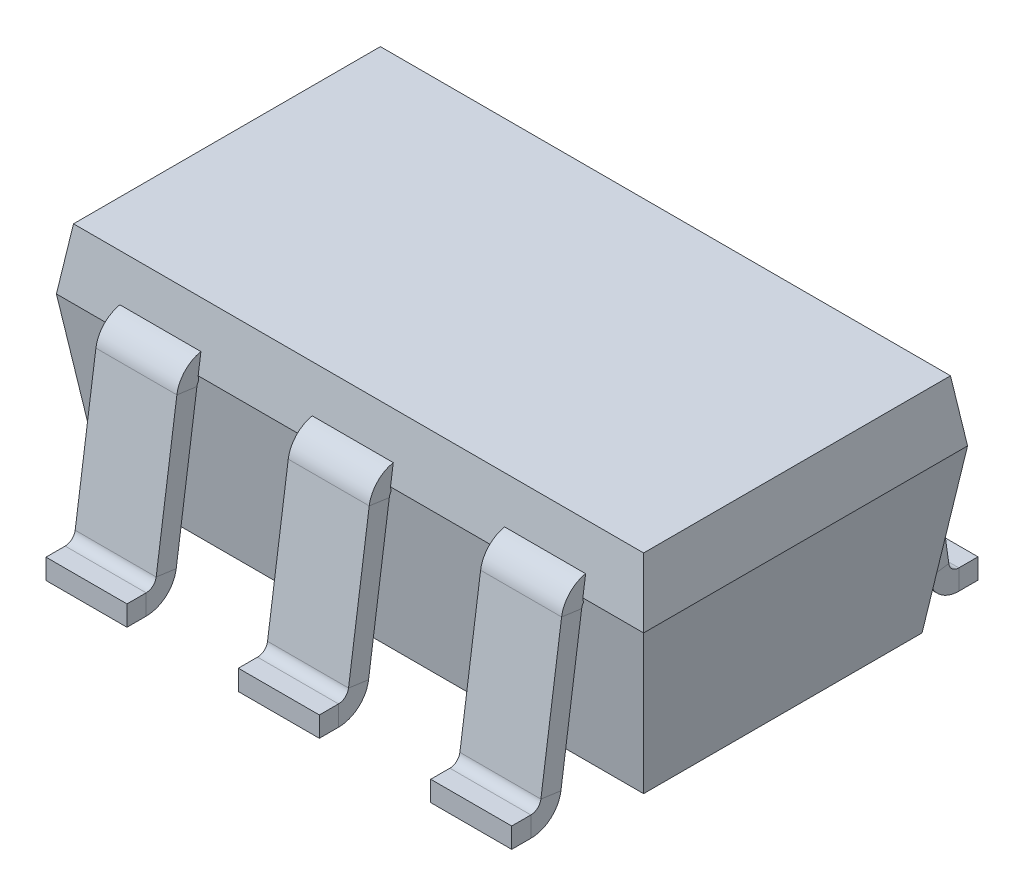
from build123d import *

# Parameters (mm, degrees)
SKETCH1_W                     = 2.9
SKETCH1_H                     = 1.6
BOSS_EXTRUDE1_DEPTH           = 0.3
BOSS_EXTRUDE1_TAPER           = 8
BOSS_EXTRUDE1_OTHER_WAY_DEPTH = 0.8
BOSS_EXTRUDE1_OTHER_WAY_TAPER = 8
BASE_FLANGE2_DEPTH            = 0.2
BASE_FLANGE3_DEPTH            = 0.2


# Sheet-metal steps are written as plain solids
with BuildPart() as part:
    # Sketch1 → Boss-Extrude1 (new body)
    with BuildSketch(Plane(origin=(0, 0, 0), x_dir=(1, 0, 0), z_dir=(0, 1, 0))):
        Rectangle(SKETCH1_W, SKETCH1_H)
    extrude(amount=BOSS_EXTRUDE1_DEPTH, taper=BOSS_EXTRUDE1_TAPER)

    # Sketch1 → Boss-Extrude1 other way (add)
    with BuildSketch(Plane(origin=(0, 0, 0), x_dir=(1, 0, 0), z_dir=(0, 1, 0))):
        Rectangle(SKETCH1_W, SKETCH1_H)
    extrude(amount=-BOSS_EXTRUDE1_OTHER_WAY_DEPTH, taper=BOSS_EXTRUDE1_OTHER_WAY_TAPER)


with BuildPart() as body_2:
    # Sketch2 → Base-Flange2 (new, symmetric)
    with BuildSketch(Plane.ZY):
        with BuildLine():
            Line((0.6, 0), (0.756535663, 0))
            ThreePointArc((0.756535663, 0), (0.789338615, -0.012264521), (0.806049067, -0.043041345))
            Line((0.806049067, -0.043041345), (0.908339552, -0.770875965))
            ThreePointArc((0.908339552, -0.770875965), (0.958470908, -0.863206437), (1.056879762, -0.9))
            Line((1.056879762, -0.9), (1.151486751, -0.9))
            Line((1.151486751, -0.9), (1.151486751, -0.8))
            Line((1.151486751, -0.8), (1.056879762, -0.8))
            ThreePointArc((1.056879762, -0.8), (1.02407681, -0.787735479), (1.007366358, -0.756958655))
            Line((1.007366358, -0.756958655), (0.905075873, -0.029124035))
            ThreePointArc((0.905075873, -0.029124035), (0.854944517, 0.063206437), (0.756535663, 0.1))
            Line((0.756535663, 0.1), (0.6, 0.1))
            Line((0.6, 0.1), (0.6, 0))
        make_face()
    extrude(amount=BASE_FLANGE2_DEPTH, both=True)


with BuildPart() as body_3:
    # Sketch11 → Base-Flange3 (new, symmetric)
    with BuildSketch(Plane.ZY.offset(0.95)):
        with BuildLine():
            Line((-0.69, 0), (-0.756535663, 0))
            ThreePointArc((-0.756535663, 0), (-0.789338615, -0.012264521), (-0.806049067, -0.043041345))
            Line((-0.806049067, -0.043041345), (-0.908339552, -0.770875965))
            ThreePointArc((-0.908339552, -0.770875965), (-0.958470908, -0.863206437), (-1.056879762, -0.9))
            Line((-1.056879762, -0.9), (-1.151486751, -0.9))
            Line((-1.151486751, -0.9), (-1.151486751, -0.8))
            Line((-1.151486751, -0.8), (-1.056879762, -0.8))
            ThreePointArc((-1.056879762, -0.8), (-1.02407681, -0.787735479), (-1.007366358, -0.756958655))
            Line((-1.007366358, -0.756958655), (-0.905075873, -0.029124035))
            ThreePointArc((-0.905075873, -0.029124035), (-0.854944517, 0.063206437), (-0.756535663, 0.1))
            Line((-0.756535663, 0.1), (-0.69, 0.1))
            Line((-0.69, 0.1), (-0.69, 0))
        make_face()
    extrude(amount=BASE_FLANGE3_DEPTH, both=True)


with BuildPart() as body_4:
    # Mirror1: mirrored copy
    add(body_3.part.mirror(Plane.ZY))


with BuildPart() as body_5:
    # Mirror2: mirrored copy
    add(body_4.part.mirror(Plane.XY))


with BuildPart() as body_6:
    # Mirror2 2: mirrored copy
    add(body_3.part.mirror(Plane.XY))


with BuildPart() as body_7:
    # Mirror2 3: mirrored copy
    add(body_2.part.mirror(Plane.XY))


solid = Compound([part.part, body_2.part, body_3.part, body_4.part, body_5.part, body_6.part, body_7.part])
